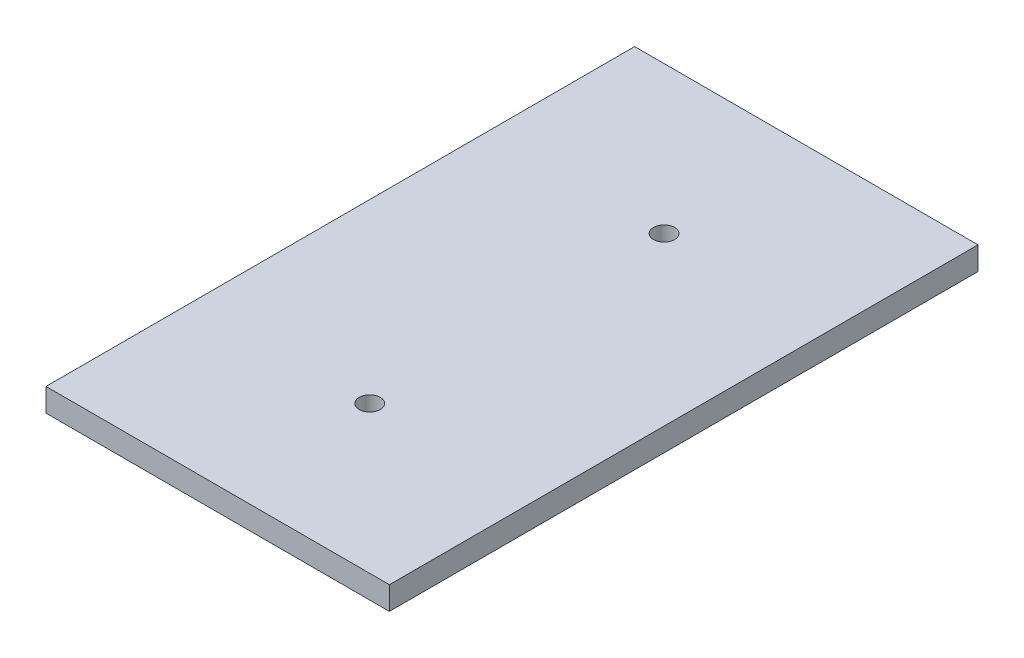
from build123d import *

# Parameters (mm, degrees)
SKETCH2_W               = 88.9
SKETCH2_H               = 152.4
BOSS_EXTRUDE1_DEPTH     = 5.9944
CUT_EXTRUDE2_DEPTH      = 177.535840076
CUT_EXTRUDE2_DEPTH_BACK = 177.535840076
SKETCH4_R               = 2.7305


with BuildPart() as part:
    # Sketch2 → Boss-Extrude1 (new body)
    with BuildSketch(Plane(origin=(0, 0, 0), x_dir=(1, 0, 0), z_dir=(0, 1, 0))):
        with Locations((44.45, 76.2)):
            Rectangle(SKETCH2_W, SKETCH2_H)
    extrude(amount=BOSS_EXTRUDE1_DEPTH)

    # Sketch4 → Cut-Extrude2 (cut, two sides: drawn at the far end of the back side and taken through both)
    with BuildSketch(Plane(origin=(0, 5.9944, 0), x_dir=(1, 0, 0), z_dir=(0, 1, 0)).offset(-CUT_EXTRUDE2_DEPTH_BACK)):
        with Locations((45.72, 114.3)):
            Circle(SKETCH4_R)
        with Locations((45.72, 38.1)):
            Circle(SKETCH4_R)
    extrude(amount=CUT_EXTRUDE2_DEPTH + CUT_EXTRUDE2_DEPTH_BACK, mode=Mode.SUBTRACT)


solid = part.part
